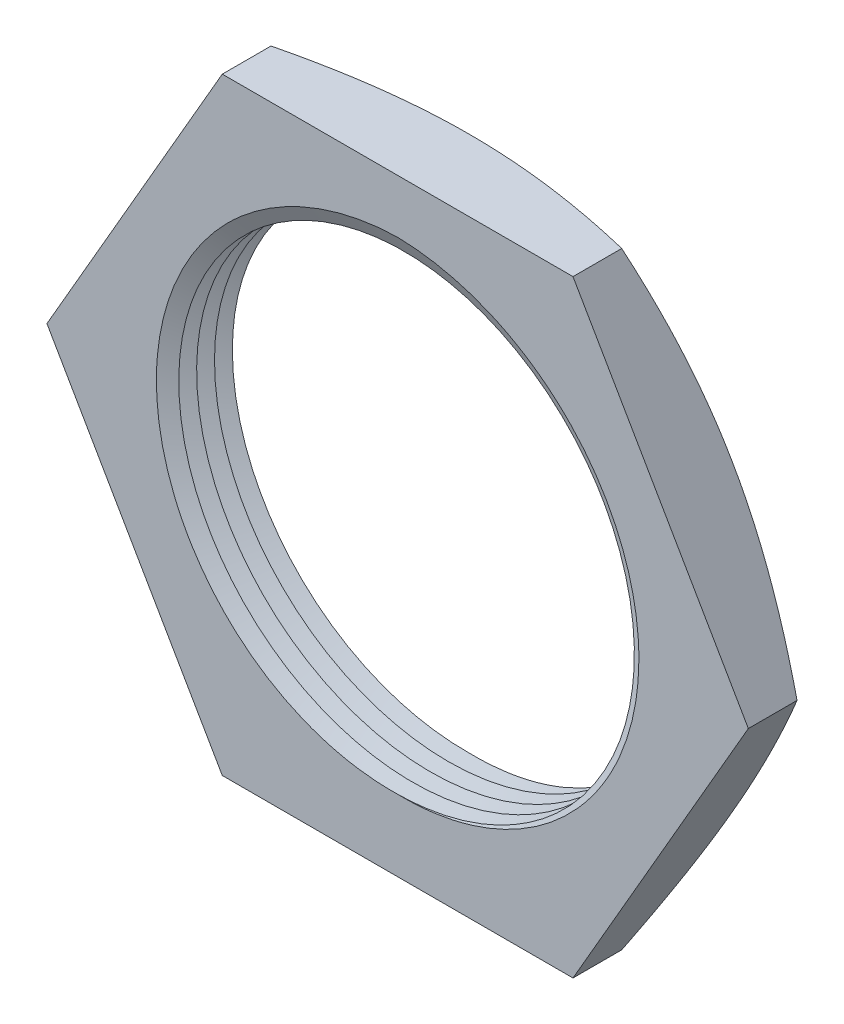
from build123d import *

# Parameters (mm, degrees)
SCHIZZO1_R                   = 13
ESTRUSIONE_ESTRUSIONE1_DEPTH = 4
TAGLIA_SWEEP1_PITCH          = 1


with BuildPart() as part:
    # Schizzo1 → Estrusione-Estrusione1 (new body)
    with BuildSketch(Plane.XY):
        Polygon((-9.814954576, -17), (9.814954576, -17), (19.629909152, 0), (9.814954576, 17), (-9.814954576, 17), (-19.629909152, 0), align=None)
        Circle(SCHIZZO1_R, mode=Mode.SUBTRACT)
    extrude(amount=ESTRUSIONE_ESTRUSIONE1_DEPTH)

    # Taglia-Sweep1: arcs per turn and ends read off the stored shape
    # Taglia-Sweep1: the profile of Schizzo2 screwed along a left-hand helix through 7 turns, 8 arcs to a turn; built about Z, then put on its axis
    taglia_sweep1_z = Axis((0, 0, 0), (0, 0, 1))
    taglia_sweep1_corners = [(13, 0, -1.375), (12.70546947, 0, -1.375), (12.70546947, 0, -2.375), (13, 0, -2.375), (14, 0, -1.875)]
    with BuildLine(mode=Mode.PRIVATE) as taglia_sweep1_profile:
        Line(taglia_sweep1_corners[0], taglia_sweep1_corners[1])
        Line(taglia_sweep1_corners[1], taglia_sweep1_corners[2])
        Line(taglia_sweep1_corners[2], taglia_sweep1_corners[3])
        Line(taglia_sweep1_corners[3], taglia_sweep1_corners[4])
        Line(taglia_sweep1_corners[4], taglia_sweep1_corners[0])
    taglia_sweep1_cap = Face(taglia_sweep1_profile.wire())
    taglia_sweep1_turn_angles = [0, -22.5, -45, -67.5, -90, -112.5, -135, -157.5, -180, -202.5, -225, -247.5, -270, -292.5, -315, -337.5, -360]
    taglia_sweep1_turn_weights = [1, 0.9238795325112867, 1, 0.9238795325112867, 1, 0.9238795325112867, 1, 0.9238795325112867, 1, 0.9238795325112867, 1, 0.9238795325112867, 1, 0.9238795325112867, 1, 0.9238795325112867, 1]
    taglia_sweep1_turn_rails = [Edge.make_bspline([Vector(p[0], p[1], 0).rotate(taglia_sweep1_z, taglia_sweep1_turn_angles[k]) / taglia_sweep1_turn_weights[k] + Vector(0, 0, p[2] + -TAGLIA_SWEEP1_PITCH * taglia_sweep1_turn_angles[k] / 360) for k in range(17)], [0, 0, 0, 1, 1, 2, 2, 3, 3, 4, 4, 5, 5, 6, 6, 7, 7, 8, 8, 8], 2, taglia_sweep1_turn_weights) for p in taglia_sweep1_corners]
    taglia_sweep1_turn_sides = [Face.make_surface_from_curves(taglia_sweep1_turn_rails[p[0]], taglia_sweep1_turn_rails[p[1]]) for p in [(0, 1), (1, 2), (2, 3), (3, 4), (4, 0)]]
    taglia_sweep1_turn = Solid(Shell([*taglia_sweep1_turn_sides, taglia_sweep1_cap, taglia_sweep1_cap.rotate(taglia_sweep1_z, -360).moved(Location((0, 0, -TAGLIA_SWEEP1_PITCH * -360 / 360)))]))
    taglia_sweep1_each = [*[taglia_sweep1_turn.moved(Location((0, 0, TAGLIA_SWEEP1_PITCH * i))) for i in range(7)]]
    add(Plane(origin=(0, 0, 0), x_dir=(0.7071067811865464, 0.7071067811865487, 0), z_dir=(0, 0, 1)) * Compound([taglia_sweep1_each[i] for i in range(0, 7, 2)]), mode=Mode.SUBTRACT)
    add(Plane(origin=(0, 0, 0), x_dir=(0.7071067811865464, 0.7071067811865487, 0), z_dir=(0, 0, 1)) * Compound([taglia_sweep1_each[i] for i in range(1, 7, 2)]), mode=Mode.SUBTRACT)

    # Schizzo4 → Taglia-Rivoluzione1 (revolve, cut)
    with BuildSketch(Plane(origin=(0, 0, 0), x_dir=(1, 0, 0), z_dir=(0, 1, 0))):
        Polygon((17, 0), (21.129909152, -2), (25.259818305, -4), (25.259818305, 1.264037402), (17, 1.264037402), align=None)
    revolve(axis=Axis((0, 0, 0), (0, 0, 1)), mode=Mode.SUBTRACT)


solid = part.part
